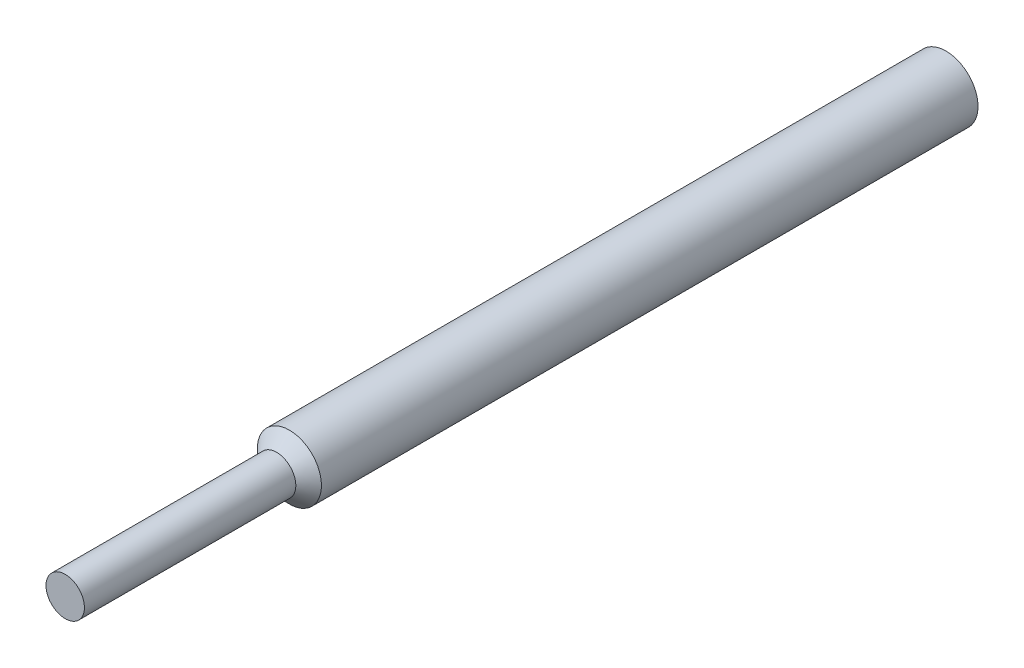
from build123d import *

# Parameters (mm, degrees)
CHAMFER1_SIZE = 4


with BuildPart() as part:
    # Sketch1 → Revolve1 (revolve)
    with BuildSketch(Plane(origin=(0, 0, 0), x_dir=(0, 0, -1), z_dir=(1, 0, 0))):
        Polygon((0, 0), (0, 6), (66, 6), (66, 10), (275, 10), (275, 0), align=None)
    revolve(axis=Axis((0, 0, -275), (0, 0, 1)))

    # Chamfer1
    chamfer1_edges = [part.edges().sort_by_distance(p)[0] for p in [
        (0, -10, -66),
    ]]
    chamfer(chamfer1_edges, length=CHAMFER1_SIZE - 0.0001)  # a hair under: the kernel refuses the full size


solid = part.part
